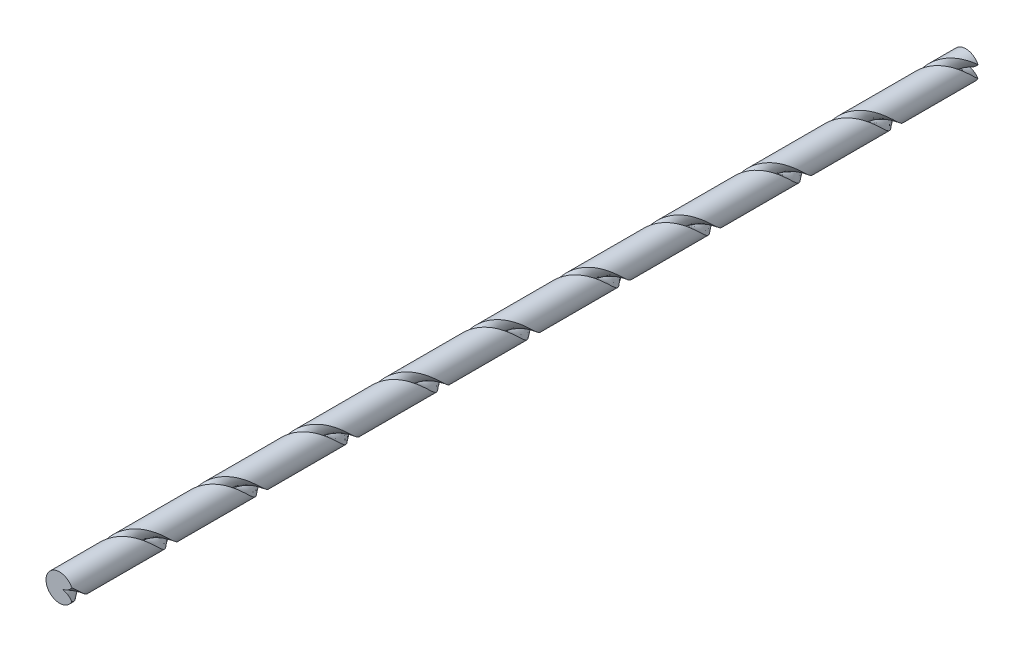
from build123d import *

# Parameters (mm, degrees)
CROQUIS1_R              = 3
SALIENTE_EXTRUIR1_DEPTH = 200
CORTAR_BARRER2_PITCH    = 20


with BuildPart() as part:
    # Croquis1 → Saliente-Extruir1 (new body)
    with BuildSketch(Plane.XY):
        Circle(CROQUIS1_R)
    extrude(amount=SALIENTE_EXTRUIR1_DEPTH)

    # Cortar-Barrer2: arcs per turn and ends read off the stored shape
    # Cortar-Barrer2: the profile of Croquis4 screwed along a right-hand helix through 61 turns, 12 arcs to a turn; built about Z, then put on its axis
    cortar_barrer2_z = Axis((0, 0, 0), (0, 0, 1))
    cortar_barrer2_corners = [(3, 0, -20), (3, 0, -18.556624327), (0.5, 0, -20), (3, 0, -21.443375673)]
    with BuildLine(mode=Mode.PRIVATE) as cortar_barrer2_profile:
        Line(cortar_barrer2_corners[0], cortar_barrer2_corners[1])
        Line(cortar_barrer2_corners[1], cortar_barrer2_corners[2])
        Line(cortar_barrer2_corners[2], cortar_barrer2_corners[3])
        Line(cortar_barrer2_corners[3], cortar_barrer2_corners[0])
    cortar_barrer2_cap = Face(cortar_barrer2_profile.wire())
    cortar_barrer2_turn_angles = [0, 15, 30, 45, 60, 75, 90, 105, 120, 135, 150, 165, 180, 195, 210, 225, 240, 255, 270, 285, 300, 315, 330, 345, 360]
    cortar_barrer2_turn_weights = [1, 0.9659258262890683, 1, 0.9659258262890683, 1, 0.9659258262890683, 1, 0.9659258262890683, 1, 0.9659258262890683, 1, 0.9659258262890683, 1, 0.9659258262890683, 1, 0.9659258262890683, 1, 0.9659258262890683, 1, 0.9659258262890683, 1, 0.9659258262890683, 1, 0.9659258262890683, 1]
    cortar_barrer2_turn_rails = [Edge.make_bspline([Vector(p[0], p[1], 0).rotate(cortar_barrer2_z, cortar_barrer2_turn_angles[k]) / cortar_barrer2_turn_weights[k] + Vector(0, 0, p[2] + CORTAR_BARRER2_PITCH * cortar_barrer2_turn_angles[k] / 360) for k in range(25)], [0, 0, 0, 1, 1, 2, 2, 3, 3, 4, 4, 5, 5, 6, 6, 7, 7, 8, 8, 9, 9, 10, 10, 11, 11, 12, 12, 12], 2, cortar_barrer2_turn_weights) for p in cortar_barrer2_corners]
    cortar_barrer2_turn_sides = [Face.make_surface_from_curves(cortar_barrer2_turn_rails[p[0]], cortar_barrer2_turn_rails[p[1]]) for p in [(0, 1), (1, 2), (2, 3), (3, 0)]]
    cortar_barrer2 = Plane(origin=(0, 0, 200), x_dir=(1, 0, 0), z_dir=(0, 0, -1)) * Solid(Shell([*[p.moved(Location((0, 0, CORTAR_BARRER2_PITCH * i))) for i in range(61) for p in cortar_barrer2_turn_sides], cortar_barrer2_cap, cortar_barrer2_cap.rotate(cortar_barrer2_z, 21960).moved(Location((0, 0, CORTAR_BARRER2_PITCH * 21960 / 360)))]))
    add(cortar_barrer2, mode=Mode.SUBTRACT)


solid = part.part
